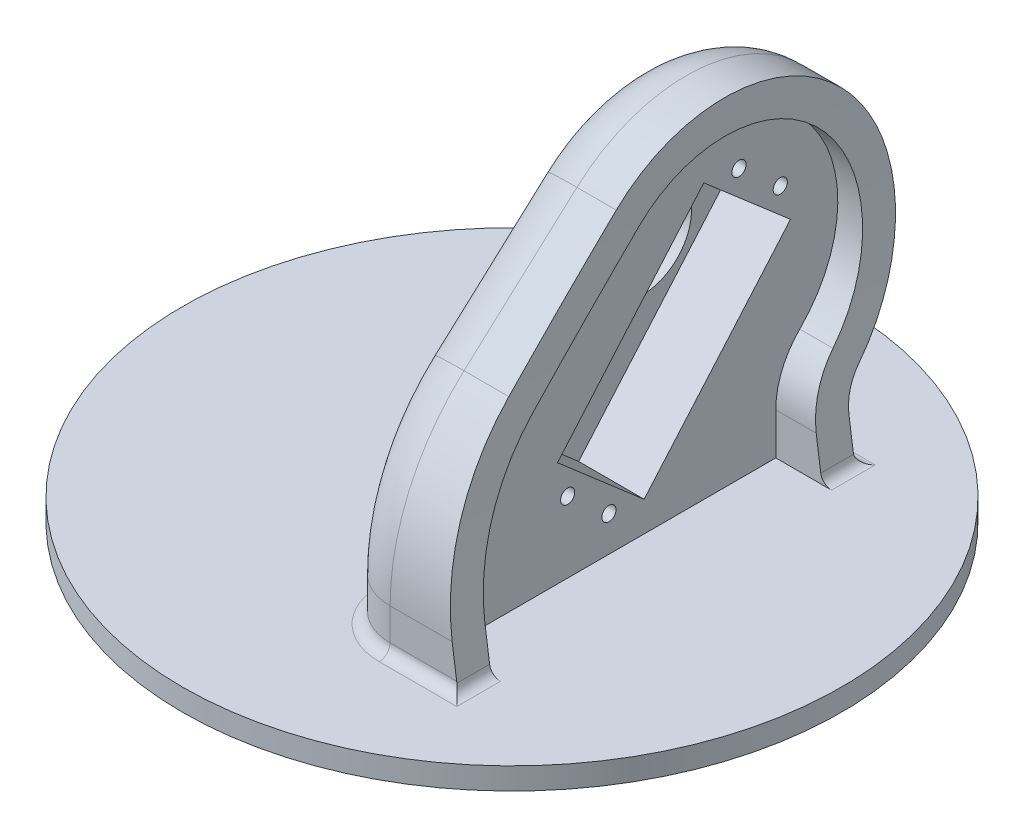
from build123d import *

# Parameters (mm, degrees)
SKETCH1_R                = 60.394691442
BOSS_EXTRUDE1_DEPTH      = 1
BOSS_EXTRUDE3_START      = 4
SKETCH3_R                = 9
BOSS_EXTRUDE3_DEPTH      = 14
CUT_EXTRUDE1_START       = 6
SKETCH4_R                = 1.3
CUT_EXTRUDE1_DEPTH       = 99.311500824
BOSS_EXTRUDE4_DEPTH      = 9
BOSS_EXTRUDE4_DEPTH_BACK = 14
CUT_EXTRUDE2_DEPTH       = 108.867849616
CUT_EXTRUDE2_DEPTH_BACK  = 108.867849616
FILLET1_R                = 10
FILLET3_R                = 2
BOSS_EXTRUDE9_START      = 3
SKETCH11_R               = 60.394691442
SKETCH11_R_2             = 56.5
BOSS_EXTRUDE9_DEPTH      = 3
SKETCH14_R               = 46.5
SKETCH14_W               = 15
SKETCH14_H               = 30
BOSS_EXTRUDE12_DEPTH     = 3
SKETCH16_R               = 2
CUT_EXTRUDE3_DEPTH       = 4


with BuildPart() as part:
    # Sketch1 → Boss-Extrude1 (new body)
    with BuildSketch(Plane(origin=(0, 0, 0), x_dir=(1, 0, 0), z_dir=(0, 1, 0))):
        with Locations(Location((0, 0, 0), (0, 0, 270))):
            Circle(SKETCH1_R)
    extrude(amount=BOSS_EXTRUDE1_DEPTH)

    # Sketch3 → Boss-Extrude3 (add)
    with BuildSketch(Plane(origin=(0, 0, 0), x_dir=(0, 0, -1), z_dir=(1, 0, 0)).offset(BOSS_EXTRUDE3_START)):
        with BuildLine():
            Line((-30.34, 1), (30.34, 1))
            Line((30.34, 1), (30.34, 8.64))
            ThreePointArc((30.34, 8.64), (31.482215556, 14.381237698), (34.73490804, 19.248111261))
            ThreePointArc((34.73490804, 19.248111261), (35.146816919, 52.490993137), (1.923997232, 53.717009602))
            Line((1.923997232, 53.717009602), (-18.767804398, 34.964811646))
            ThreePointArc((-18.767804398, 34.964811646), (-27.317276732, 23.137402619), (-30.34, 8.86))
            Line((-30.34, 8.86), (-30.34, 1))
        make_face()
        with Locations(Location((17.907195719, 36.080614483, 0), (0, 0, 180))):
            Circle(SKETCH3_R, mode=Mode.SUBTRACT)
    extrude(amount=BOSS_EXTRUDE3_DEPTH)

    # Sketch4 → Cut-Extrude1 (cut, through all)
    with BuildSketch(Plane(origin=(0, 0, 0), x_dir=(0, 0, -1), z_dir=(1, 0, 0)).offset(CUT_EXTRUDE1_START)):
        with Locations(Location((23.599251188, 50.305537875, 0), (0, 0, 180))):
            Circle(SKETCH4_R)
        with Locations(Location((31.162882913, 43.764018545, 0), (0, 0, 180))):
            Circle(SKETCH4_R)
        with Locations(Location((-0.236409868, 7.458586268, 0), (0, 0, 180))):
            Circle(SKETCH4_R)
        with Locations(Location((-7.800041592, 14.000105597, 0), (0, 0, 180))):
            Circle(SKETCH4_R)
        Polygon((17.149721975, 51.256102402), (33.033348596, 37.518911811), (6.213119346, 6.50802174), (-9.670507276, 20.245212332), align=None)
    extrude(amount=CUT_EXTRUDE1_DEPTH, mode=Mode.SUBTRACT)

    # Sketch8 → Boss-Extrude4 (add, two sides: drawn at the far end of the back side and taken through both)
    with BuildSketch(Plane(origin=(18, 0, 0), x_dir=(0, 0, -1), z_dir=(1, 0, 0)).offset(-BOSS_EXTRUDE4_DEPTH_BACK)):
        with BuildLine():
            Line((-30.34, 1), (-30.34, 8.86))
            ThreePointArc((-30.34, 8.86), (-27.317276732, 23.137402619), (-18.767804398, 34.964811646))
            Line((-18.767804398, 34.964811646), (1.923997232, 53.717009602))
            ThreePointArc((1.923997232, 53.717009602), (35.146816919, 52.490993137), (34.73490804, 19.248111261))
            ThreePointArc((34.73490804, 19.248111261), (31.482215556, 14.381237698), (30.34, 8.64))
            Line((30.34, 8.64), (30.34, 1))
            Line((30.34, 1), (36.34, 1))
            Line((36.34, 1), (36.34, 8.64))
            ThreePointArc((36.34, 8.64), (37.025329334, 12.084742619), (38.976944824, 15.004866757))
            ThreePointArc((38.976944824, 15.004866757), (39.492690314, 56.627825795), (-2.105149131, 58.162904291))
            Line((-2.105149131, 58.162904291), (-22.796950761, 39.410706335))
            ThreePointArc((-22.796950761, 39.410706335), (-32.802478559, 25.568978426), (-36.34, 8.86))
            Line((-36.34, 8.86), (-36.34, 1))
            Line((-36.34, 1), (-30.34, 1))
        make_face()
    extrude(amount=BOSS_EXTRUDE4_DEPTH + BOSS_EXTRUDE4_DEPTH_BACK)

    # Sketch10 → Cut-Extrude2 (cut, two sides: drawn at the far end of the back side and taken through both)
    with BuildSketch(Plane.XY.offset(-CUT_EXTRUDE2_DEPTH_BACK)):
        with BuildLine():
            Line((27, 65.881981391), (21, 65.881981391))
            ThreePointArc((21, 65.881981391), (22.692685718, 33.351362906), (26.5, 1))
            Line((26.5, 1), (27, 1))
            Line((27, 1), (27, 65.881981391))
        make_face()
    extrude(amount=CUT_EXTRUDE2_DEPTH + CUT_EXTRUDE2_DEPTH_BACK, mode=Mode.SUBTRACT)

    # Fillet1
    fillet1_edges = [part.edges().sort_by_distance(p)[0] for p in [
        (4, 12.084742619, -37.025329334),
        (4, 25.568978426, 32.802478559),
        (4, 4.93, 36.34),
        (4, 4.82, -36.34),
        (4, 56.627825795, -39.492690314),
        (4, 48.786805313, 12.451049946),
    ]]
    fillet(fillet1_edges, radius=FILLET1_R)

    # Fillet3
    fillet3_edges = [part.edges().sort_by_distance(p)[0] for p in [
        (20.25, 1, -36.34),
        (6.928932188, 1, -33.411067812),
        (4, 1, 0),
        (6.928932188, 1, 33.411067812),
        (20.25, 1, 36.34),
    ]]
    fillet(fillet3_edges, radius=FILLET3_R)
    fillet3_2_edges = [part.edges().sort_by_distance(p)[0] for p in [
        (26.5, 1, -33.34),
    ]]
    fillet(fillet3_2_edges, radius=FILLET3_R)
    fillet3_3_edges = [part.edges().sort_by_distance(p)[0] for p in [
        (26.5, 1, 33.34),
    ]]
    fillet(fillet3_3_edges, radius=FILLET3_R)

    # Sketch11 → Boss-Extrude9 (add)
    with BuildSketch(Plane.XZ.offset(BOSS_EXTRUDE9_START)):
        with Locations(Location((0, 0, 0), (0, 0, 270))):
            Circle(SKETCH11_R)
        with Locations(Location((0, 0, 0), (0, 0, 270))):
            Circle(SKETCH11_R_2, mode=Mode.SUBTRACT)
    extrude(amount=-BOSS_EXTRUDE9_DEPTH)

    # Sketch14 → Boss-Extrude12 (add)
    with BuildSketch(Plane(origin=(0, 0, 0), x_dir=(-1, 0, 0), z_dir=(0, -1, 0))):
        with Locations(Location((0, 0, 0), (0, 0, 270))):
            Circle(SKETCH14_R)
        Rectangle(SKETCH14_W, SKETCH14_H, mode=Mode.SUBTRACT)
    extrude(amount=BOSS_EXTRUDE12_DEPTH)

    # Sketch16 → Cut-Extrude3 (cut)
    with BuildSketch(Plane(origin=(0, 0, 0), x_dir=(-1, 0, 0), z_dir=(0, -1, 0))):
        with Locations(Location((5.032683159, 10, 0), (0, 0, 90))):
            Circle(SKETCH16_R)
        with Locations(Location((5.032683159, -10, 0), (0, 0, 90))):
            Circle(SKETCH16_R)
    extrude(amount=-CUT_EXTRUDE3_DEPTH, mode=Mode.SUBTRACT)


solid = part.part
